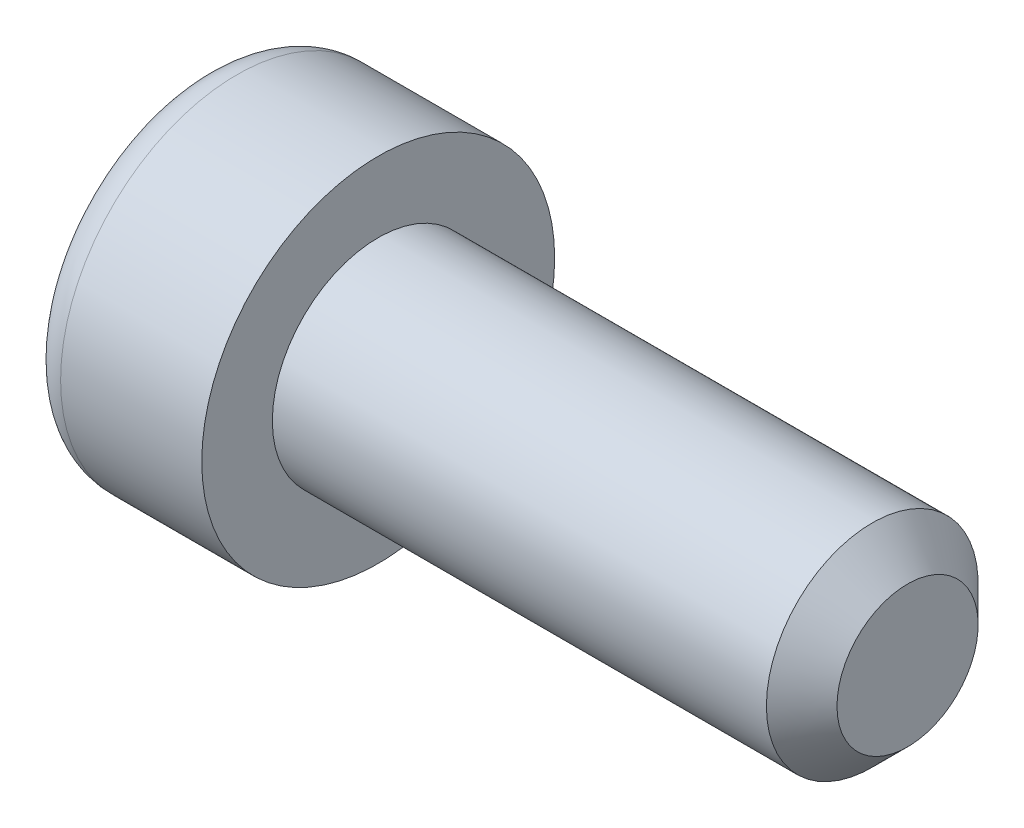
from build123d import *

# Parameters (mm, degrees)
ENL_V_MAT_EXTRU_1_DEPTH = 3


with BuildPart() as part:
    # Esquisse1 → Révolution1 (revolve)
    with BuildSketch(Plane.XY):
        with BuildLine():
            Line((41.305464296, 0), (41.305464296, 2))
            Line((41.305464296, 2), (40.305464296, 3))
            Line((40.305464296, 3), (26.305464296, 3))
            Line((26.305464296, 3), (26.305464296, 5))
            Line((26.305464296, 5), (22.305464296, 5))
            ThreePointArc((22.305464296, 5), (21.598357515, 4.707106781), (21.305464296, 4))
            Line((21.305464296, 4), (21.305464296, 0))
            Line((21.305464296, 0), (41.305464296, 0))
        make_face()
    revolve(axis=Axis((-45.608623826, 0, 0), (1, 0, 0)))

    # Esquisse2 → Enlèv. mat.-Extru.1 (cut)
    with BuildSketch(Plane.ZY.offset(-21.305464296)):
        Polygon((0, 2.235751884), (-1.936217928, 1.117875942), (-1.936217928, -1.117875942), (0, -2.235751884), (1.936217928, -1.117875942), (1.936217928, 1.117875942), align=None)
    extrude(amount=-ENL_V_MAT_EXTRU_1_DEPTH, mode=Mode.SUBTRACT)


solid = part.part
